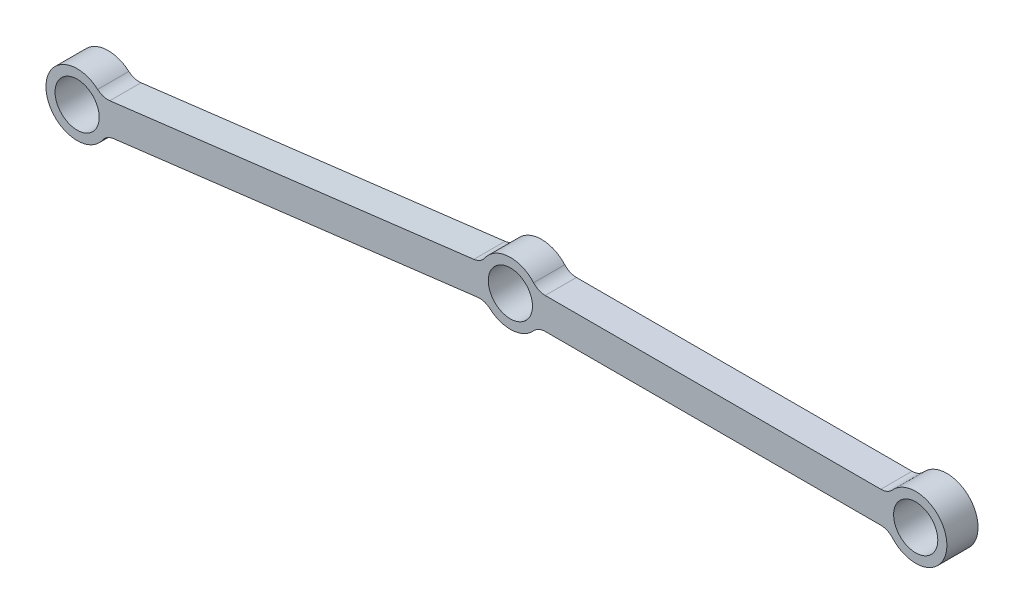
from build123d import *

# Parameters (mm, degrees)
SKETCH1_R           = 4.49961
BOSS_EXTRUDE2_DEPTH = 6.35
FILLET2_R           = 3.175


with BuildPart() as part:
    # Sketch1 → Boss-Extrude2 (new body)
    with BuildSketch(Plane.XY):
        with BuildLine():
            Line((-5.845205819, 2.481142666), (-83.166017392, -7.012659232))
            ThreePointArc((-83.166017392, -7.012659232), (-94.540020944, -11.608054959), (-82.392147061, -13.315327295))
            Line((-82.392147061, -13.315327295), (-5.071335489, -3.821525397))
            ThreePointArc((-5.071335489, -3.821525397), (0.387658226, -6.33815597), (5.499261314, -3.175))
            Line((5.499261314, -3.175), (77.050738686, -3.175))
            ThreePointArc((77.050738686, -3.175), (88.9, 0), (77.050738686, 3.175))
            Line((77.050738686, 3.175), (5.499261314, 3.175))
            ThreePointArc((5.499261314, 3.175), (-0.387658226, 6.33815597), (-5.845205819, 2.481142666))
        make_face()
        Circle(SKETCH1_R, mode=Mode.SUBTRACT)
        with Locations((-88.237352881, -10.834184629)):
            Circle(SKETCH1_R, mode=Mode.SUBTRACT)
        with Locations((82.55, 0)):
            Circle(SKETCH1_R, mode=Mode.SUBTRACT)
    extrude(amount=-BOSS_EXTRUDE2_DEPTH)

    # Fillet2
    fillet2_edges = [part.edges().sort_by_distance(p)[0] for p in [
        (77.050738686, 3.175, -3.175),
        (77.050738686, -3.175, -3.175),
        (-5.071335489, -3.821525397, -3.175),
        (-5.845205819, 2.481142666, -3.175),
        (5.499261314, 3.175, -3.175),
        (5.499261314, -3.175, -3.175),
        (-82.392147061, -13.315327295, -3.175),
        (-83.166017392, -7.012659232, -3.175),
    ]]
    fillet(fillet2_edges, radius=FILLET2_R)


solid = part.part
